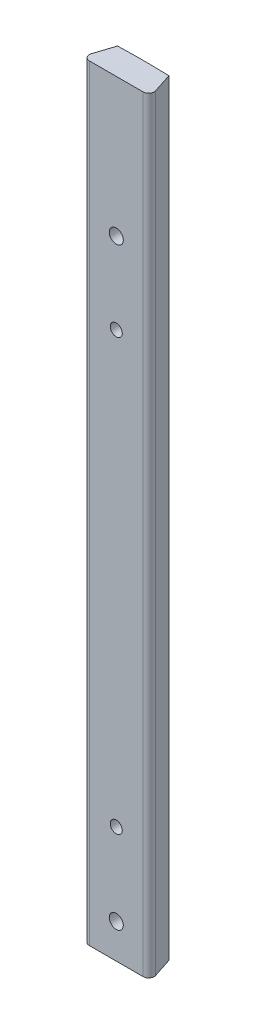
from build123d import *

# Parameters (mm, degrees)
BOSS_EXTRUDE1_DEPTH                                 = 178
CBORE_FOR_4_BINDING_HEAD_MACHINE_SCREW3_D           = 3.2639
CBORE_FOR_4_BINDING_HEAD_MACHINE_SCREW3_CBORE_D     = 6.74624
CBORE_FOR_4_BINDING_HEAD_MACHINE_SCREW3_CBORE_DEPTH = 1.7272
SKETCH3_R                                           = 1.397
CUT_EXTRUDE1_DEPTH                                  = 179.292844883
FILLET1_R                                           = 1.27


with BuildPart() as part:
    # Sketch2 → Boss-Extrude1 (new body)
    with BuildSketch(Plane(origin=(0, 0, 0), x_dir=(1, 0, 0), z_dir=(0, 1, 0))):
        with BuildLine():
            Line((8.001, -203.2), (-8.001, -203.2))
            Line((-8.001, -203.2), (-5.969, -196.937688608))
            ThreePointArc((-5.969, -196.937688608), (0, -196.85), (5.969, -196.937688608))
            Line((5.969, -196.937688608), (8.001, -203.2))
        make_face()
    extrude(amount=BOSS_EXTRUDE1_DEPTH)

    # CBORE for #4 Binding Head Machine Screw3 (through all)
    with Locations(Plane(origin=(0, 8, 196.85), x_dir=(-1, 0, 0), z_dir=(0, 0, -1))):
        with Locations((0, 0), (0, 137.875371205)):
            CounterBoreHole(CBORE_FOR_4_BINDING_HEAD_MACHINE_SCREW3_D / 2, CBORE_FOR_4_BINDING_HEAD_MACHINE_SCREW3_CBORE_D / 2, CBORE_FOR_4_BINDING_HEAD_MACHINE_SCREW3_CBORE_DEPTH)

    # Sketch3 → Cut-Extrude1 (cut, through all)
    with BuildSketch(Plane.XY.offset(196.85)):
        with Locations((0, 27)):
            Circle(SKETCH3_R)
        with Locations((0, 127)):
            Circle(SKETCH3_R)
    extrude(amount=CUT_EXTRUDE1_DEPTH, mode=Mode.SUBTRACT)

    # Fillet1
    fillet1_edges = [part.edges().sort_by_distance(p)[0] for p in [
        (8.001, 89, 203.2),
        (-8.001, 89, 203.2),
    ]]
    fillet(fillet1_edges, radius=FILLET1_R)


solid = part.part
